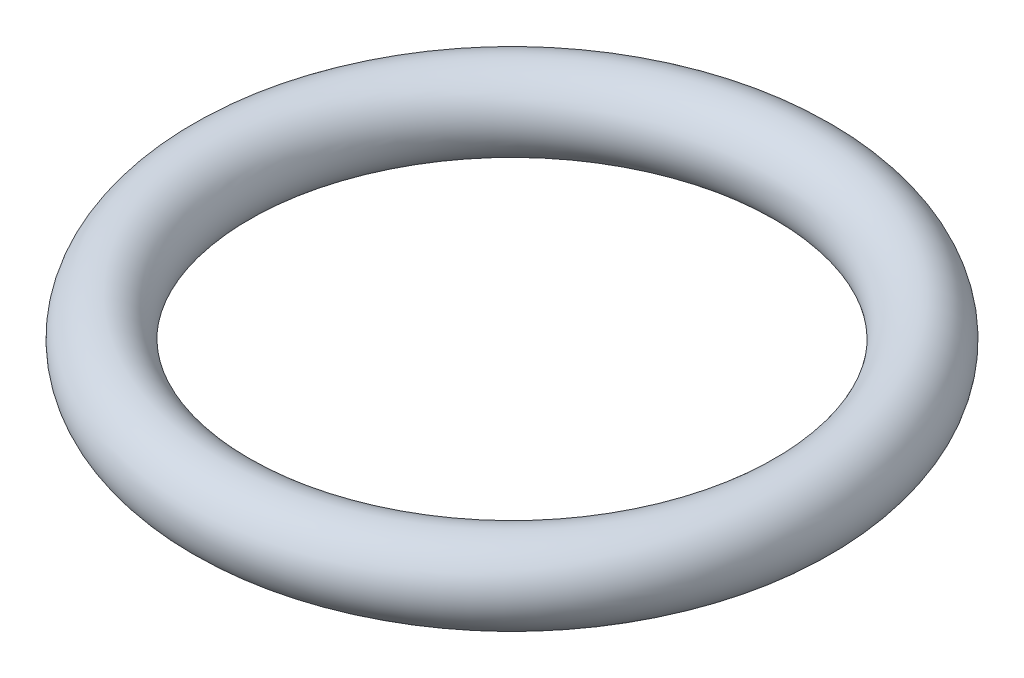
from build123d import *

# Parameters (mm, degrees)
ESBO_O1_R = 0.75


with BuildPart() as part:
    # Esboço1 → Revolução1 (revolve)
    with BuildSketch(Plane.XY):
        with Locations((5.55, 0)):
            Circle(ESBO_O1_R)
    revolve(axis=Axis((0, 0, 0), (0, 1, 0)))


solid = part.part
